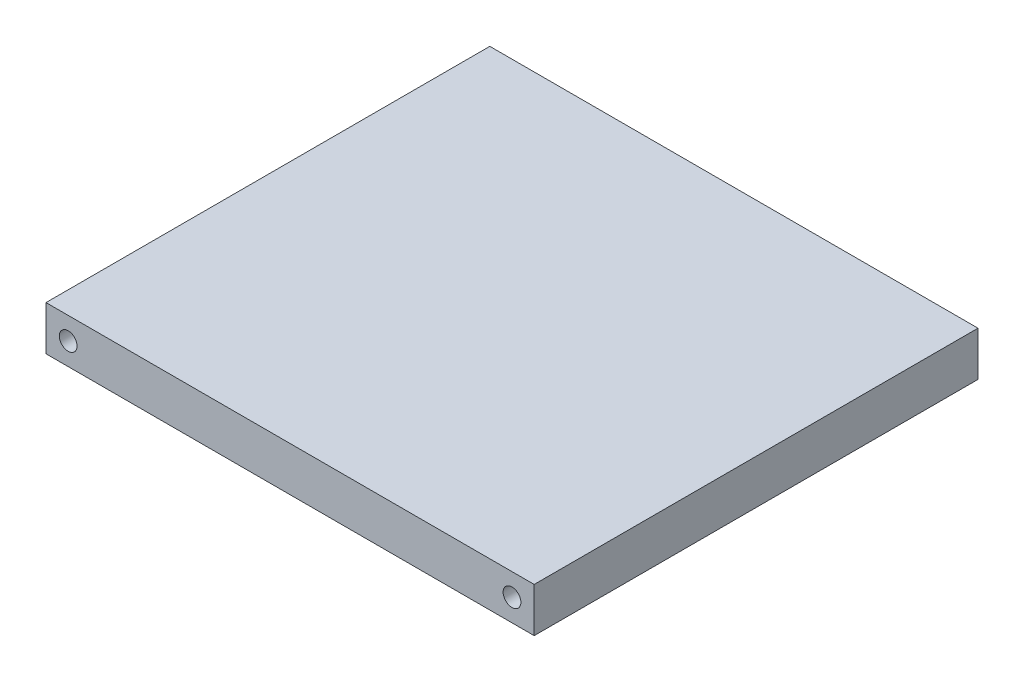
from build123d import *

# Parameters (mm, degrees)
SKETCH1_W           = 110
SKETCH1_H           = 100
BOSS_EXTRUDE1_DEPTH = 10
SKETCH2_R           = 2
CUT_EXTRUDE1_DEPTH  = 115.564392374


with BuildPart() as part:
    # Sketch1 → Boss-Extrude1 (new body)
    with BuildSketch(Plane(origin=(0, 0, 0), x_dir=(1, 0, 0), z_dir=(0, 1, 0))):
        Rectangle(SKETCH1_W, SKETCH1_H)
    extrude(amount=BOSS_EXTRUDE1_DEPTH)

    # Sketch2 → Cut-Extrude1 (cut, through all)
    with BuildSketch(Plane.XY.offset(50)):
        with Locations((-50, 5)):
            Circle(SKETCH2_R)
        with Locations((50, 5)):
            Circle(SKETCH2_R)
    extrude(amount=-CUT_EXTRUDE1_DEPTH, mode=Mode.SUBTRACT)


solid = part.part
